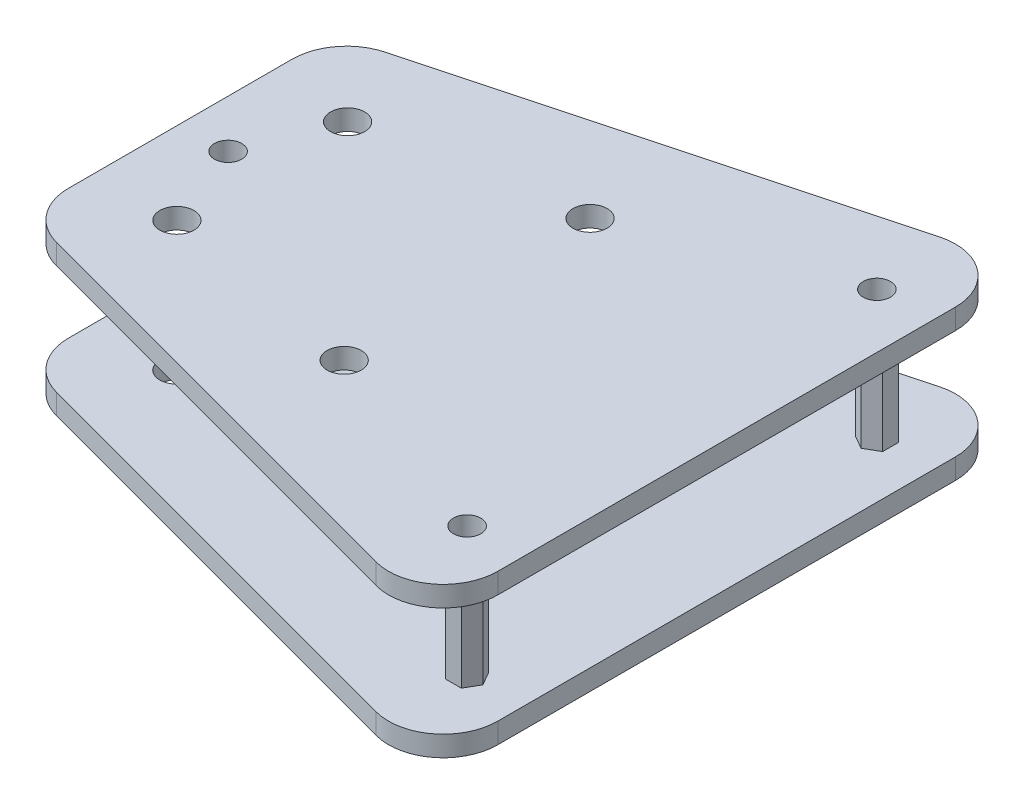
from build123d import *

# Parameters (mm, degrees)
CROQUIS1_R                = 2.5
CROQUIS1_R_2              = 2
SALIENTE_EXTRUIR1_DEPTH   = 22
CROQUIS2_W                = 80
CROQUIS2_H                = 16
CORTAR_EXTRUIR1_DEPTH     = 50
SALIENTE_EXTRUIR2_DEPTH   = 16
SALIENTE_EXTRUIR2_2_DEPTH = 16
SALIENTE_EXTRUIR2_3_DEPTH = 16


with BuildPart() as part:
    # Croquis1 → Saliente-Extruir1 (new body)
    with BuildSketch(Plane(origin=(0, 0, 0), x_dir=(1, 0, 0), z_dir=(0, 1, 0))):
        with BuildLine():
            Line((0, 16.361384096), (0, -16.361384096))
            ThreePointArc((0, -16.361384096), (1.653173278, -21.231475528), (5.929447639, -24.088790706))
            Line((5.929447639, -24.088790706), (69.929447639, -41.237539022))
            ThreePointArc((69.929447639, -41.237539022), (76.870091432, -39.856959134), (80, -33.510132412))
            Line((80, -33.510132412), (80, 33.510132412))
            ThreePointArc((80, 33.510132412), (76.870091432, 39.856959134), (69.929447639, 41.237539022))
            Line((69.929447639, 41.237539022), (5.929447639, 24.088790706))
            ThreePointArc((5.929447639, 24.088790706), (1.653173278, 21.231475528), (0, 16.361384096))
        make_face()
        with Locations((12, 12.5)):
            Circle(CROQUIS1_R, mode=Mode.SUBTRACT)
        with Locations((12, -12.5)):
            Circle(CROQUIS1_R, mode=Mode.SUBTRACT)
        with Locations((42, 18)):
            Circle(CROQUIS1_R, mode=Mode.SUBTRACT)
        with Locations((42, -18)):
            Circle(CROQUIS1_R, mode=Mode.SUBTRACT)
        with Locations((7, 0)):
            Circle(CROQUIS1_R_2, mode=Mode.SUBTRACT)
        with Locations((72, -30)):
            Circle(CROQUIS1_R_2, mode=Mode.SUBTRACT)
        with Locations((72, 30)):
            Circle(CROQUIS1_R_2, mode=Mode.SUBTRACT)
    extrude(amount=SALIENTE_EXTRUIR1_DEPTH)

    # Croquis2 → Cortar-Extruir1 (cut, symmetric)
    with BuildSketch(Plane.XY):
        with Locations((40, 11)):
            Rectangle(CROQUIS2_W, CROQUIS2_H)
    extrude(amount=CORTAR_EXTRUIR1_DEPTH, both=True, mode=Mode.SUBTRACT)


with BuildPart() as cortar_extruir1_piece_1:
    # of the separate pieces the step leaves, piece 1, a body of its own (cortar_extruir1_pieces)
    add(part.part.solids().sort_by_distance((69.929447639, 0, -41.237539022))[0])


with BuildPart() as cortar_extruir1_piece_2:
    # of the separate pieces the step leaves, piece 2, a body of its own (cortar_extruir1_pieces)
    add(part.part.solids().sort_by_distance((5.929447639, 19, -24.088790706))[0])


with BuildPart() as body_3:
    # Croquis3 → Saliente-Extruir2 (new body)
    with BuildSketch(Plane(origin=(0, 3, 0), x_dir=(1, 0, 0), z_dir=(0, 1, 0))):
        Polygon((7, -2.309401077), (9, -1.154700538), (9, 1.154700538), (7, 2.309401077), (5, 1.154700538), (5, -1.154700538), align=None)
    extrude(amount=SALIENTE_EXTRUIR2_DEPTH)


with BuildPart() as body_4:
    # Croquis3 → Saliente-Extruir2 2 (new body)
    with BuildSketch(Plane(origin=(0, 3, 0), x_dir=(1, 0, 0), z_dir=(0, 1, 0))):
        Polygon((70.845299462, -32), (73.154700538, -32), (74.309401077, -30), (73.154700538, -28), (70.845299462, -28), (69.690598923, -30), align=None)
    extrude(amount=SALIENTE_EXTRUIR2_2_DEPTH)


with BuildPart() as body_5:
    # Croquis3 → Saliente-Extruir2 3 (new body)
    with BuildSketch(Plane(origin=(0, 3, 0), x_dir=(1, 0, 0), z_dir=(0, 1, 0))):
        Polygon((74, 28.845299462), (74, 31.154700538), (72, 32.309401077), (70, 31.154700538), (70, 28.845299462), (72, 27.690598923), align=None)
    extrude(amount=SALIENTE_EXTRUIR2_3_DEPTH)


solid = Compound([cortar_extruir1_piece_1.part, cortar_extruir1_piece_2.part, body_3.part, body_4.part, body_5.part])
